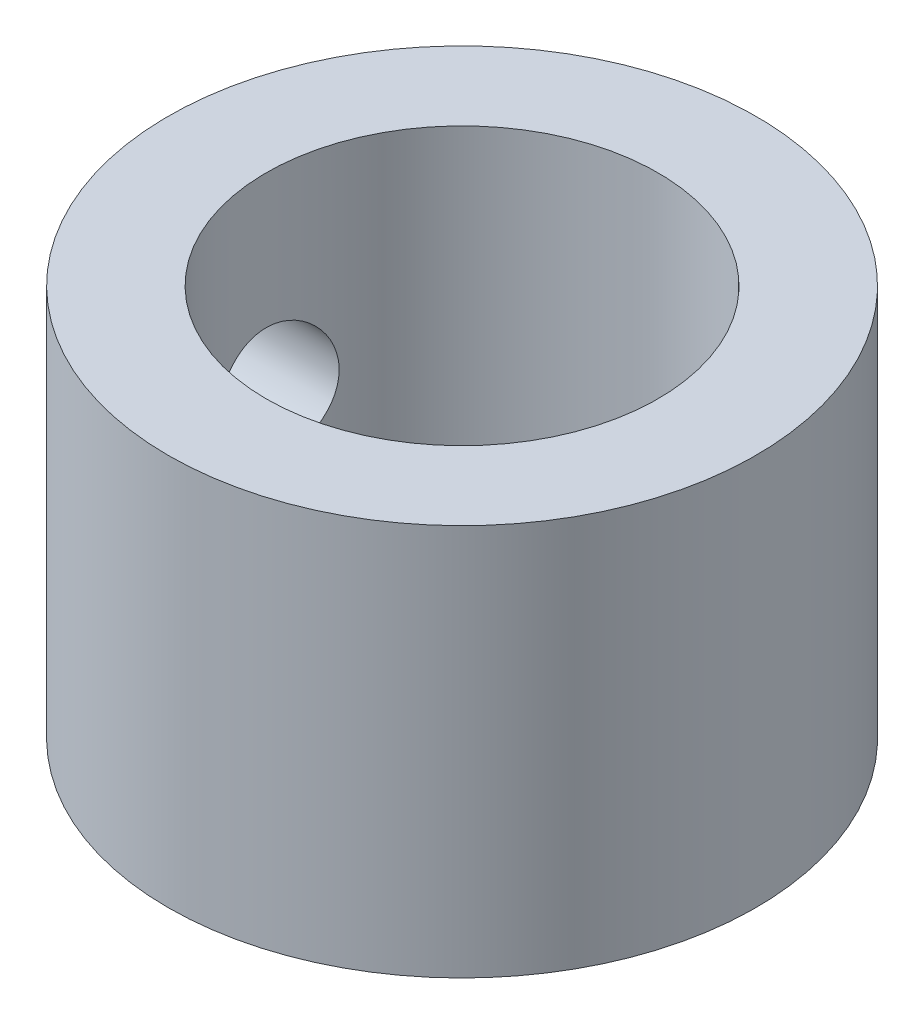
from build123d import *

# Parameters (mm, degrees)
SKETCH1_R           = 9.525
BOSS_EXTRUDE1_DEPTH = 12.7
SKETCH2_R           = 6.35
CUT_EXTRUDE1_DEPTH  = 9.525
SKETCH3_R           = 2.032
CUT_EXTRUDE2_DEPTH  = 19.513272266


with BuildPart() as part:
    # Sketch1 → Boss-Extrude1 (new body)
    with BuildSketch(Plane(origin=(0, 0, 0), x_dir=(1, 0, 0), z_dir=(0, 1, 0))):
        Circle(SKETCH1_R)
    extrude(amount=BOSS_EXTRUDE1_DEPTH)

    # Sketch2 → Cut-Extrude1 (cut)
    with BuildSketch(Plane(origin=(0, 12.7, 0), x_dir=(1, 0, 0), z_dir=(0, 1, 0))):
        Circle(SKETCH2_R)
    extrude(amount=-CUT_EXTRUDE1_DEPTH, mode=Mode.SUBTRACT)

    # Sketch3 → Cut-Extrude2 (cut, through all)
    with BuildSketch(Plane(origin=(0, 0, 0), x_dir=(0, 0, -1), z_dir=(1, 0, 0))):
        with Locations((0, 6.318769588)):
            Circle(SKETCH3_R)
    extrude(amount=-CUT_EXTRUDE2_DEPTH, mode=Mode.SUBTRACT)


solid = part.part
